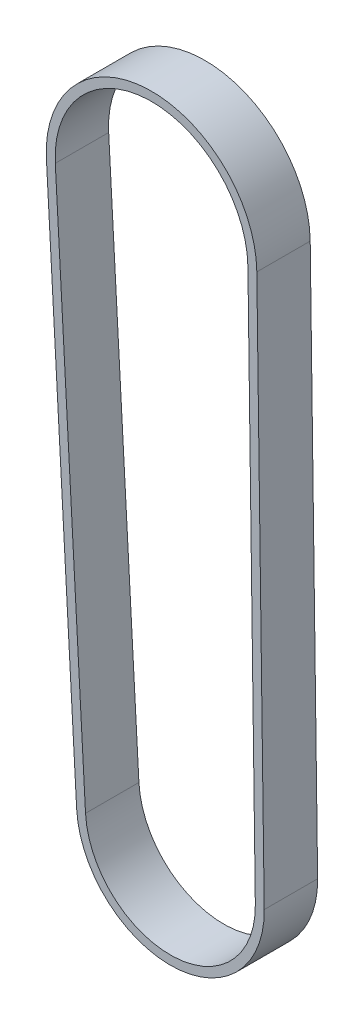
from build123d import *

# Parameters (mm, degrees)
EXTRUDE_THIN1_DEPTH = 9


with BuildPart() as part:
    # Sketch2 → Extrude-Thin1 (new body)
    with BuildSketch(Plane.XY):
        with BuildLine():
            Line((17.748380795, 0.23974809), (18.997501375, -92.231761087))
            ThreePointArc((18.997501375, -92.231761087), (3.718146216, -108.260114646), (-12.624882358, -93.317818004))
            Line((-12.624882358, -93.317818004), (-17.723008642, -0.978501243))
            ThreePointArc((-17.723008642, -0.978501243), (-0.609256757, 17.739540755), (17.748380795, 0.23974809))
        make_face()
        with BuildLine():
            Line((16.248517629, 0.219487688), (17.49763821, -92.252021489))
            ThreePointArc((17.49763821, -92.252021489), (3.66665973, -106.760998525), (-11.127163318, -93.235127759))
            Line((-11.127163318, -93.235127759), (-16.225289602, -0.895810997))
            ThreePointArc((-16.225289602, -0.895810997), (-0.55777027, 16.240424635), (16.248517629, 0.219487688))
        make_face(mode=Mode.SUBTRACT)
    extrude(amount=-EXTRUDE_THIN1_DEPTH)


solid = part.part
